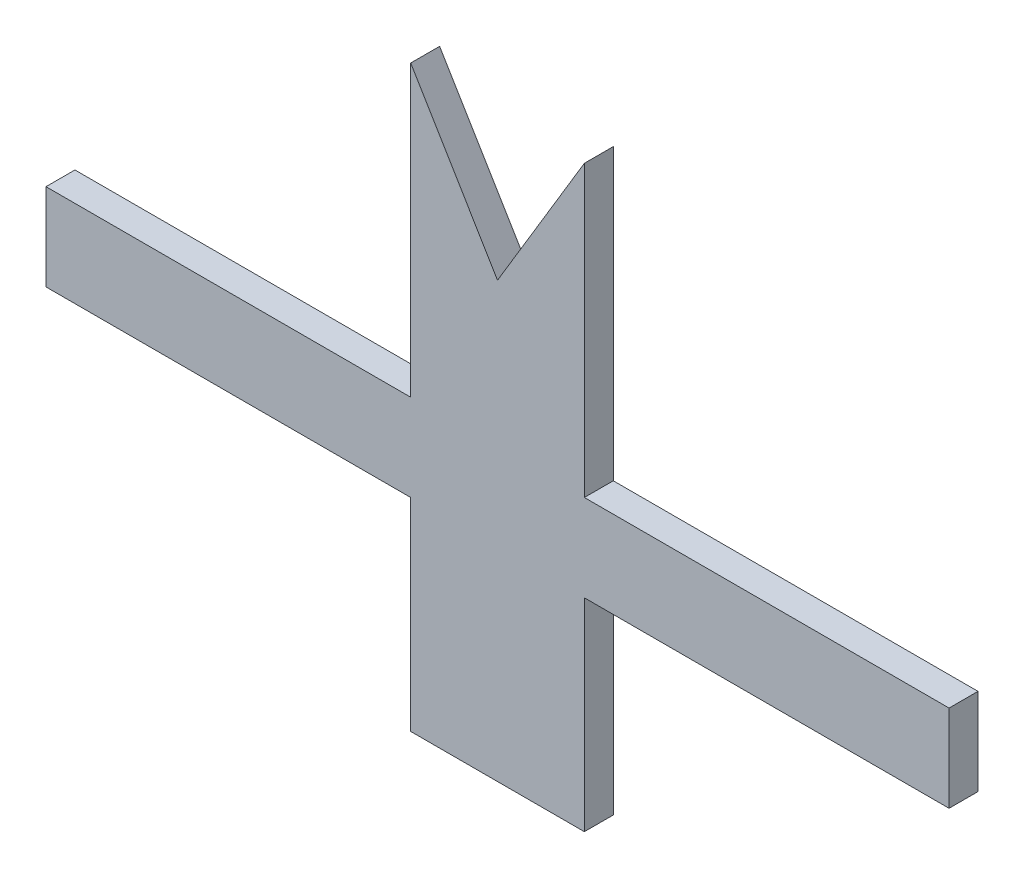
from build123d import *

# Parameters (mm, degrees)
BOSS_EXTRUDE1_DEPTH = 10


with BuildPart() as part:
    # Sketch1 → Boss-Extrude1 (new body)
    with BuildSketch(Plane.XY):
        Polygon((0, 70), (0, 0), (60, 0), (60, 70), (186, 70), (186, 100), (60, 100), (60, 200), (30, 150), (0, 200), (0, 100), (-126, 100), (-126, 70), align=None)
    extrude(amount=BOSS_EXTRUDE1_DEPTH)


solid = part.part
